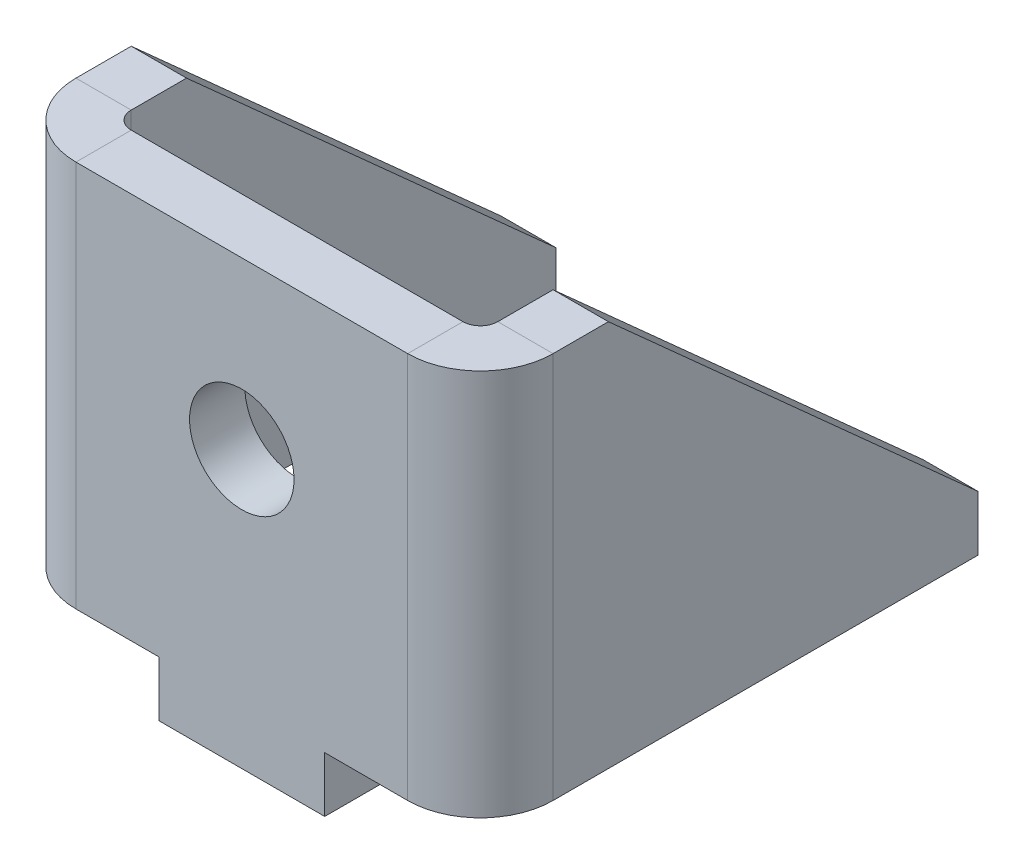
from build123d import *

# Parameters (mm, degrees)
SKETCH1_W           = 19.05
SKETCH1_H           = 22.225
BASE_FLANGE1_DEPTH  = 3.175
EDGE_FLANGE1_DEPTH  = 22.225
EDGE_FLANGE2_DEPTH  = 22.225
CUT_EXTRUDE1_DEPTH  = 42.119074421
SKETCH13_W          = 9.525
SKETCH13_H          = 3.175
BOSS_EXTRUDE1_DEPTH = 3.175
CUT_EXTRUDE2_DEPTH  = 35.761376285


# Sheet-metal steps are written as plain solids
with BuildPart() as part:
    # Sketch1 → Base-Flange1 (new body)
    with BuildSketch(Plane.XY):
        Rectangle(SKETCH1_W, SKETCH1_H)
    extrude(amount=-BASE_FLANGE1_DEPTH)

    # Edge-Flange1 section (across the edge) → Edge-Flange1 (add)
    with BuildSketch(Plane(origin=(10.525, 11.1125, -3.175), x_dir=(-1, 0, 0), z_dir=(0, -1, 0))):
        with BuildLine():
            Line((-3.175, 1), (-3.175, 25.4))
            Line((-3.175, 25.4), (0, 25.4))
            Line((0, 25.4), (0, 1))
            ThreePointArc((0, 1), (0.292893219, 0.292893219), (1, 0))
            Line((1, 0), (1, -3.175))
            ThreePointArc((1, -3.175), (-1.952170811, -1.952170811), (-3.175, 1))
        make_face()
    extrude(amount=EDGE_FLANGE1_DEPTH)

    # Edge-Flange2 section (across the edge) → Edge-Flange2 (add)
    with BuildSketch(Plane(origin=(-10.525, -11.1125, -3.175), x_dir=(1, 0, 0), z_dir=(0, 1, 0))):
        with BuildLine():
            Line((-3.175, 1), (-3.175, 25.4))
            Line((-3.175, 25.4), (0, 25.4))
            Line((0, 25.4), (0, 1))
            ThreePointArc((0, 1), (0.292893219, 0.292893219), (1, 0))
            Line((1, 0), (1, -3.175))
            ThreePointArc((1, -3.175), (-1.952170811, -1.952170811), (-3.175, 1))
        make_face()
    extrude(amount=EDGE_FLANGE2_DEPTH)

    # Sketch12 → Cut-Extrude1 (cut, through all)
    with BuildSketch(Plane(origin=(13.7, 0, 0), x_dir=(0, 0, -1), z_dir=(1, 0, 0))):
        Polygon((28.575, 11.1125), (7.35, 11.1125), (28.575, -7.9375), align=None)
    extrude(amount=-CUT_EXTRUDE1_DEPTH, mode=Mode.SUBTRACT)

    # Sketch13 → Boss-Extrude1 (add)
    with BuildSketch(Plane.XZ.offset(11.1125)):
        with Locations((0, -1.5875)):
            Rectangle(SKETCH13_W, SKETCH13_H)
    extrude(amount=BOSS_EXTRUDE1_DEPTH)

    # Sketch14 → Cut-Extrude2 (cut, through all)
    with BuildSketch(Plane.XY):
        with BuildLine():
            ThreePointArc((-3, 1.5875), (0, -1.4125), (3, 1.5875))
            Line((3, 1.5875), (-3, 1.5875))
        make_face()
        with BuildLine():
            Line((-3, 1.5875), (3, 1.5875))
            ThreePointArc((3, 1.5875), (0, 4.5875), (-3, 1.5875))
        make_face()
    extrude(amount=-CUT_EXTRUDE2_DEPTH, mode=Mode.SUBTRACT)


solid = part.part
